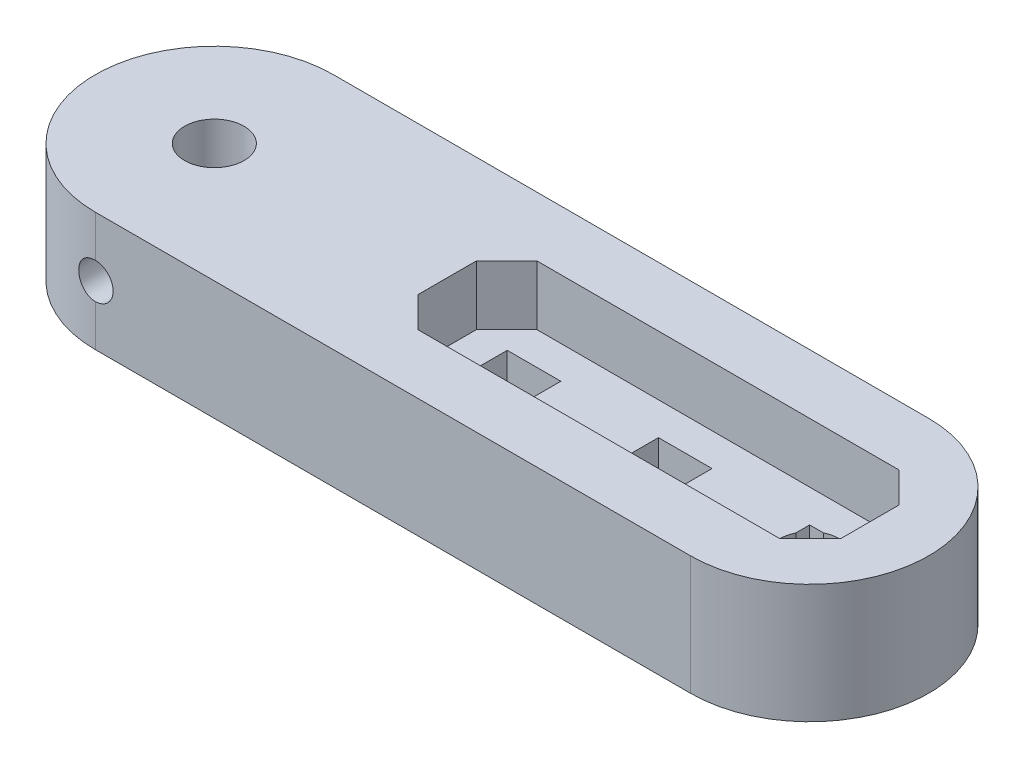
from build123d import *

# Parameters (mm, degrees)
SKETCH1_R           = 2.5
BOSS_EXTRUDE1_DEPTH = 10
SKETCH2_W           = 4.5
SKETCH2_H           = 4.5
CUT_EXTRUDE1_DEPTH  = 62.64414003
CUT_EXTRUDE2_DEPTH  = 5
SKETCH4_R           = 1.5
CUT_EXTRUDE3_DEPTH  = 9


with BuildPart() as part:
    # Sketch1 → Boss-Extrude1 (new body)
    with BuildSketch(Plane(origin=(0, 0, 0), x_dir=(1, 0, 0), z_dir=(0, 1, 0))):
        with BuildLine():
            Line((0, -10), (-50, -10))
            ThreePointArc((-50, -10), (-60, 0), (-50, 10))
            Line((-50, 10), (0, 10))
            ThreePointArc((0, 10), (10, 0), (0, -10))
        make_face()
        Circle(SKETCH1_R, mode=Mode.SUBTRACT)
        with Locations((-50, 0)):
            Circle(SKETCH1_R, mode=Mode.SUBTRACT)
    extrude(amount=BOSS_EXTRUDE1_DEPTH)

    # Sketch2 → Cut-Extrude1 (cut, through all)
    with BuildSketch(Plane(origin=(0, 10, 0), x_dir=(1, 0, 0), z_dir=(0, 1, 0))):
        Rectangle(SKETCH2_W, SKETCH2_H)
        with Locations((-12.7, 0)):
            Rectangle(SKETCH2_W, SKETCH2_H)
        with Locations((-25.4, 0)):
            Rectangle(SKETCH2_W, SKETCH2_H)
    extrude(amount=-CUT_EXTRUDE1_DEPTH, mode=Mode.SUBTRACT)

    # Sketch3 → Cut-Extrude2 (cut)
    with BuildSketch(Plane(origin=(0, 10, 0), x_dir=(1, 0, 0), z_dir=(0, 1, 0))):
        Polygon((-27.91, 5), (-30.45, 2.46), (-30.45, -2.46), (-27.91, -5), (2.51, -5), (5.05, -2.46), (5.05, 2.46), (2.51, 5), align=None)
    extrude(amount=-CUT_EXTRUDE2_DEPTH, mode=Mode.SUBTRACT)

    # Sketch4 → Cut-Extrude3 (cut)
    with BuildSketch(Plane.XY.offset(10)):
        with Locations((-50, 5)):
            Circle(SKETCH4_R)
    extrude(amount=-CUT_EXTRUDE3_DEPTH, mode=Mode.SUBTRACT)


solid = part.part
